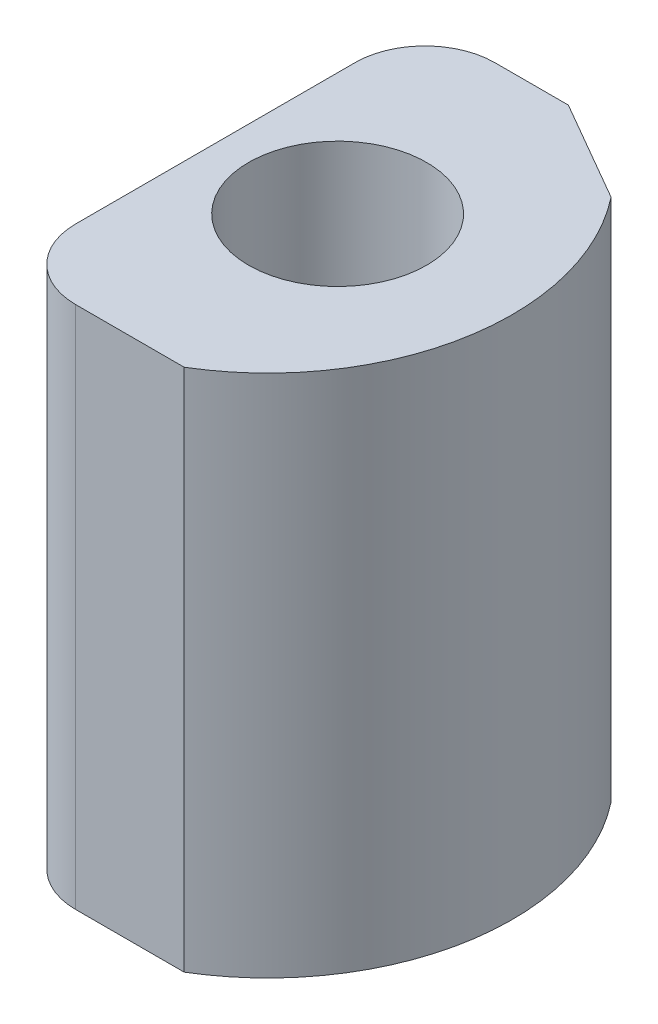
from build123d import *

# Parameters (mm, degrees)
SKETCH1_R           = 5.1
BOSS_EXTRUDE1_DEPTH = 30
FILLET1_R           = 4
CHAMFER1_SIZE       = 2


with BuildPart() as part:
    # Sketch1 → Boss-Extrude1 (new body)
    with BuildSketch(Plane(origin=(0, 0, 0), x_dir=(1, 0, 0), z_dir=(0, 1, 0))):
        with BuildLine():
            Line((3.211102551, 12), (-7, 12))
            Line((-7, 12), (-7, -12))
            Line((-7, -12), (3.211102551, -12))
            ThreePointArc((3.211102551, -12), (10, 0), (3.211102551, 12))
        make_face()
        with Locations(Location((0, 0, 0), (0, 0, 270))):
            Circle(SKETCH1_R, mode=Mode.SUBTRACT)
    extrude(amount=BOSS_EXTRUDE1_DEPTH)

    # Fillet1
    fillet1_edges = [part.edges().sort_by_distance(p)[0] for p in [
        (-7, 15, 12),
        (-7, 15, -12),
    ]]
    fillet(fillet1_edges, radius=FILLET1_R)

    # Chamfer1
    # the kernel refuses this chamfer: 57.143323993, 2 mm, written as the material it takes off along each edge
    with BuildSketch(Plane(origin=(3.211102551, -18.277403027, -12), x_dir=(-1, 0, 0), z_dir=(0, 1, 0))) as chamfer1_piece_1:
        with BuildLine():
            Line((CHAMFER1_SIZE, 0), (-3.792467803, 3.344282846))
            ThreePointArc((-3.792467803, 3.344282846), (-2.856773862, 2.271800551), (0, 0))
            Line((0, 0), (CHAMFER1_SIZE, 0))
        make_face()
    extrude(amount=66.554806053, mode=Mode.SUBTRACT)


solid = part.part
